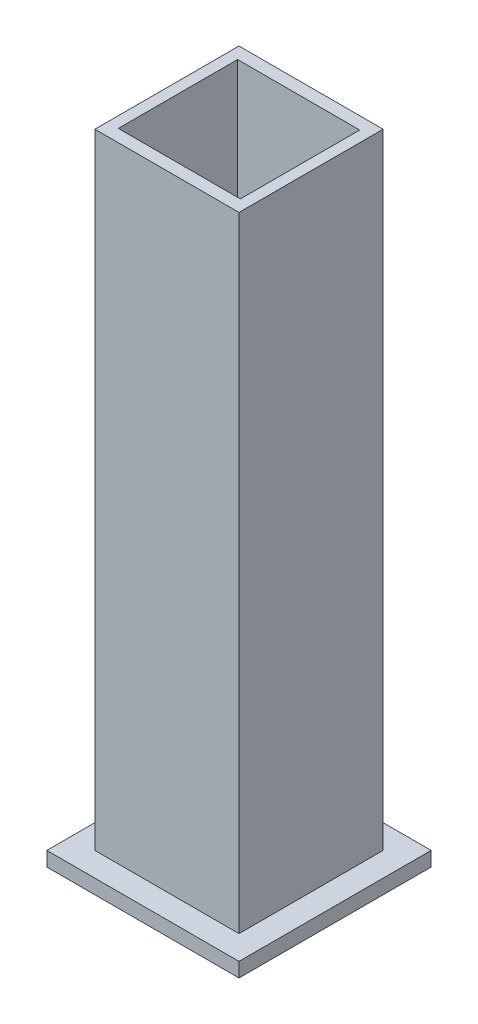
from build123d import *

# Parameters (mm, degrees)
CROQUIS1_W              = 40
CROQUIS1_H              = 40
SALIENTE_EXTRUIR1_DEPTH = 3
CROQUIS2_W              = 30
CROQUIS2_H              = 30
CROQUIS2_W_2            = 20.424171228
CROQUIS2_H_2            = 20.424171228
SALIENTE_EXTRUIR2_DEPTH = 130
CROQUIS3_W              = 25.408720236
CROQUIS3_H              = 24.82795655
CORTAR_EXTRUIR1_DEPTH   = 30


with BuildPart() as part:
    # Croquis1 → Saliente-Extruir1 (new body)
    with BuildSketch(Plane(origin=(0, 0, 0), x_dir=(1, 0, 0), z_dir=(0, 1, 0))):
        Rectangle(CROQUIS1_W, CROQUIS1_H)
    extrude(amount=SALIENTE_EXTRUIR1_DEPTH)

    # Croquis2 → Saliente-Extruir2 (add)
    with BuildSketch(Plane(origin=(0, 3, 0), x_dir=(1, 0, 0), z_dir=(0, 1, 0))):
        Rectangle(CROQUIS2_W, CROQUIS2_H)
        Rectangle(CROQUIS2_W_2, CROQUIS2_H_2, mode=Mode.SUBTRACT)
    extrude(amount=SALIENTE_EXTRUIR2_DEPTH)

    # Croquis3 → Cortar-Extruir1 (cut)
    with BuildSketch(Plane(origin=(0, 133, 0), x_dir=(1, 0, 0), z_dir=(0, 1, 0))):
        Rectangle(CROQUIS3_W, CROQUIS3_H)
    extrude(amount=-CORTAR_EXTRUIR1_DEPTH, mode=Mode.SUBTRACT)


solid = part.part
